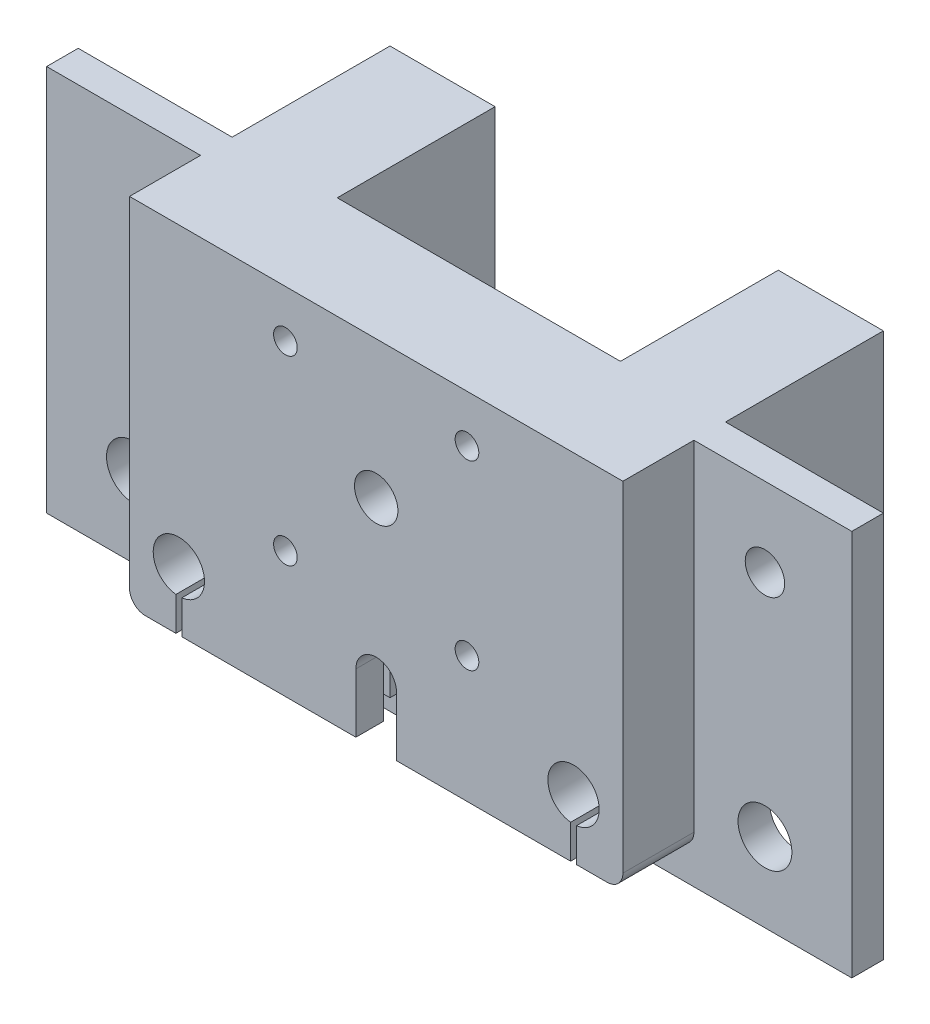
from build123d import *
from build123d.topology import SkipClean

# Parameters (mm, degrees)
SKETCH1_W           = 62.5
SKETCH1_H           = 45
BOSS_EXTRUDE1_DEPTH = 20
SKETCH2_W           = 37.5
SKETCH2_H           = 45
CUT_EXTRUDE1_DEPTH  = 5
SKETCH3_R           = 11.5
CUT_EXTRUDE2_DEPTH  = 2
SKETCH4_R           = 1.5
CUT_EXTRUDE3_DEPTH  = 15
CIRPATTERN1_COUNT   = 4
SKETCH5_R           = 2.75
CUT_EXTRUDE4_DEPTH  = 58.667690261
CUT_EXTRUDE7_START  = -6.5
CUT_EXTRUDE7_DEPTH  = 3
CUT_EXTRUDE8_DEPTH  = 6.5
CUT_EXTRUDE9_DEPTH  = 5.5
SKETCH11_R          = 1.375
CUT_EXTRUDE10_DEPTH = 80.569152314
FILLET1_R           = 2
SKETCH12_R          = 3.625
CUT_EXTRUDE12_DEPTH = 3
BOSS_EXTRUDE2_START = 20
BOSS_EXTRUDE2_DEPTH = 20
SKETCH14_R          = 4
CUT_EXTRUDE18_DEPTH = 2
SKETCH15_W          = 62.5
SKETCH15_H          = 45
CUT_EXTRUDE19_DEPTH = 7
SKETCH16_R          = 3.25
CUT_EXTRUDE20_DEPTH = 64.957505524
SKETCH17_R          = 1.375
CUT_EXTRUDE21_DEPTH = 79.008012512
SKETCH18_W          = 19.875
SKETCH18_H          = 4
BOSS_EXTRUDE3_DEPTH = 4
SKETCH19_R          = 3.41
SKETCH19_R_2        = 2.5
CUT_EXTRUDE22_DEPTH = 10


with BuildPart() as part:
    # Sketch1 → Boss-Extrude1 (new body)
    with BuildSketch(Plane.XY):
        with Locations((0, 22.5)):
            Rectangle(SKETCH1_W, SKETCH1_H)
    extrude(amount=BOSS_EXTRUDE1_DEPTH)

    # Sketch2 → Cut-Extrude1 (cut)
    with BuildSketch(Plane.XY.offset(20)):
        with Locations((0, 22.5)):
            Rectangle(SKETCH2_W, SKETCH2_H)
    extrude(amount=-CUT_EXTRUDE1_DEPTH, mode=Mode.SUBTRACT)

    # Sketch3 → Cut-Extrude2 (cut)
    with BuildSketch(Plane(origin=(0, 0, 0), x_dir=(-1, 0, 0), z_dir=(0, 0, -1))):
        with Locations((0, 27.5)):
            Circle(SKETCH3_R)
    extrude(amount=-CUT_EXTRUDE2_DEPTH, mode=Mode.SUBTRACT)

    # Sketch4 → Cut-Extrude3 (cut)
    with BuildSketch(Plane(origin=(0, 0, 0), x_dir=(-1, 0, 0), z_dir=(0, 0, -1))):
        with Locations((11.5, 39)):
            Circle(SKETCH4_R)
    cut_extrude3 = extrude(amount=-CUT_EXTRUDE3_DEPTH, mode=Mode.SUBTRACT)

    # CirPattern1: Cut-Extrude3 ×4 about axis
    cirpattern1_axis = Axis((0, 27.5, 0), (0, 0, 1))
    for i in range(1, CIRPATTERN1_COUNT):
        add(cut_extrude3.rotate(cirpattern1_axis, i * 360 / CIRPATTERN1_COUNT), mode=Mode.SUBTRACT)

    # Sketch5 → Cut-Extrude4 (cut, through all)
    with BuildSketch(Plane(origin=(0, 0, 2), x_dir=(-1, 0, 0), z_dir=(0, 0, -1))):
        with Locations((0, 27.5)):
            Circle(SKETCH5_R)
    extrude(amount=-CUT_EXTRUDE4_DEPTH, mode=Mode.SUBTRACT)

    # Sketch8 → Cut-Extrude7 (cut)
    with BuildSketch(Plane(origin=(0, 0, 0), x_dir=(-1, 0, 0), z_dir=(0, 0, -1)).offset(CUT_EXTRUDE7_START)):
        with BuildLine():
            Line((7.125, 0), (-7.125, 0))
            Line((-7.125, 0), (-7.125, 11.75))
            ThreePointArc((-7.125, 11.75), (-6.539213562, 13.164213562), (-5.125, 13.75))
            Line((-5.125, 13.75), (5.125, 13.75))
            ThreePointArc((5.125, 13.75), (6.539213562, 13.164213562), (7.125, 11.75))
            Line((7.125, 11.75), (7.125, 0))
        make_face()
    extrude(amount=-CUT_EXTRUDE7_DEPTH, mode=Mode.SUBTRACT)

    # Sketch9 → Cut-Extrude8 (cut)
    with BuildSketch(Plane(origin=(0, 0, 0), x_dir=(-1, 0, 0), z_dir=(0, 0, -1))):
        with BuildLine():
            Line((4.75, 7.5), (4.75, 0))
            Line((4.75, 0), (-4.75, 0))
            Line((-4.75, 0), (-4.75, 7.5))
            ThreePointArc((-4.75, 7.5), (0, 12.25), (4.75, 7.5))
        make_face()
    extrude(amount=-CUT_EXTRUDE8_DEPTH, mode=Mode.SUBTRACT)

    # Sketch10 → Cut-Extrude9 (cut)
    with BuildSketch(Plane.XY.offset(15)):
        with BuildLine():
            Line((2.575, 7.5), (2.575, 0))
            Line((2.575, 0), (-2.575, 0))
            Line((-2.575, 0), (-2.575, 7.5))
            ThreePointArc((-2.575, 7.5), (0, 10.075), (2.575, 7.5))
        make_face()
    extrude(amount=-CUT_EXTRUDE9_DEPTH, mode=Mode.SUBTRACT)

    # Sketch11 → Cut-Extrude10 (cut, through all)
    with BuildSketch(Plane(origin=(31.25, 0, 0), x_dir=(0, 0, -1), z_dir=(1, 0, 0))):
        with Locations(Location((-17.5, 2.5, 0), (0, 0, 90))):
            Circle(SKETCH11_R)
    extrude(amount=-CUT_EXTRUDE10_DEPTH, mode=Mode.SUBTRACT)

    # Fillet1
    # the kernel refuses this fillet: 2 mm, written as the material it takes off along each edge
    with BuildSketch(Plane(origin=(31.25, 0, -5), x_dir=(0, 1, 0), z_dir=(0, 0, 1)), Plane(origin=(-31.25, 0, -5), x_dir=(1, 0, 0), z_dir=(0, 0, 1))) as fillet1_piece_1:
        with BuildLine():
            CenterArc((FILLET1_R, FILLET1_R), FILLET1_R, 180, 90)
            Line((0, FILLET1_R), (0, 0))
            Line((0, 0), (FILLET1_R, 0))
        make_face()
    extrude(amount=30, mode=Mode.SUBTRACT)

    # Sketch12 → Cut-Extrude12 (cut)
    with BuildSketch(Plane(origin=(31.25, 0, 0), x_dir=(0, 0, -1), z_dir=(1, 0, 0))):
        with Locations((-17.5, 2.5)):
            Circle(SKETCH12_R)
    cut_extrude12 = extrude(amount=-CUT_EXTRUDE12_DEPTH, mode=Mode.SUBTRACT)

    # Mirror3: Cut-Extrude12 across plane
    add(cut_extrude12.mirror(Plane(origin=(0, 0, 0), x_dir=(0, 0, 1), z_dir=(1, 0, 0))), mode=Mode.SUBTRACT)

    # Sketch13 → Boss-Extrude2 (add)
    with SkipClean():  # the faces are left unmerged after this step: merging them gives an invalid solid
        with BuildSketch(Plane(origin=(0, 0, 0), x_dir=(-1, 0, 0), z_dir=(0, 0, -1)).offset(BOSS_EXTRUDE2_START)):
            with BuildLine():
                Line((17.93986046, 0), (29.25, 0))
                ThreePointArc((29.25, 0), (30.664213562, 0.585786438), (31.25, 2))
                Line((31.25, 2), (31.25, 45))
                Line((31.25, 45), (17.93986046, 45))
                Line((17.93986046, 45), (17.93986046, 0))
            make_face()
        boss_extrude2 = extrude(amount=-BOSS_EXTRUDE2_DEPTH)

    # Sketch14 → Cut-Extrude18 (cut)
    with SkipClean():  # the faces are left unmerged after this step: merging them gives an invalid solid
        with BuildSketch(Plane.ZY.offset(31.25)):
            with BuildLine():
                ThreePointArc((-20, 3.891941091), (-20.187003937, 3.207106781), (-20.25, 2.5))
                ThreePointArc((-20.25, 2.5), (-19.58802197, 0.296001514), (-17.821195336, -1.178497685))
                ThreePointArc((-17.821195336, -1.178497685), (-14.259364049, -0.969491103), (-12.281373033, 2))
                Line((-12.281373033, 2), (-20, 2))
                Line((-20, 2), (-20, 3.891941091))
            make_face()
            with BuildLine():
                ThreePointArc((-12.25, 2.5), (-15.542893219, 6.437003937), (-20, 3.891941091))
                Line((-20, 3.891941091), (-20, 2))
                Line((-20, 2), (-12.281373033, 2))
                ThreePointArc((-12.281373033, 2), (-12.257850963, 2.24950835), (-12.25, 2.5))
            make_face()
            with BuildLine():
                ThreePointArc((-17.821195336, -1.178497685), (-19.58802197, 0.296001514), (-20.25, 2.5))
                Line((-20.25, 2.5), (-20.25, -1.178497685))
                Line((-20.25, -1.178497685), (-17.821195336, -1.178497685))
            make_face()
            with Locations((-6.25, 2.5)):
                Circle(SKETCH14_R)
        cut_extrude18 = extrude(amount=-CUT_EXTRUDE18_DEPTH, mode=Mode.SUBTRACT)

    # Sketch15 → Cut-Extrude19 (cut)
    with SkipClean():  # the faces are left unmerged after this step: merging them gives an invalid solid
        with BuildSketch(Plane.XY.offset(20)):
            with Locations((0, 22.5)):
                Rectangle(SKETCH15_W, SKETCH15_H)
        extrude(amount=-CUT_EXTRUDE19_DEPTH, mode=Mode.SUBTRACT)

    # Sketch16 → Cut-Extrude20 (cut, through all)
    with SkipClean():  # the faces are left unmerged after this step: merging them gives an invalid solid
        with BuildSketch(Plane.XY.offset(13)):
            with BuildLine():
                Line((-24.625, 0), (-24.625, 4.271707107))
                ThreePointArc((-24.625, 4.271707107), (-25, 4.25), (-25.375, 4.271707107))
                Line((-25.375, 4.271707107), (-25.375, 0))
                Line((-25.375, 0), (-24.625, 0))
            make_face()
            with Locations((-25, 7.5)):
                Circle(SKETCH16_R)
        cut_extrude20 = extrude(amount=-CUT_EXTRUDE20_DEPTH, mode=Mode.SUBTRACT)

    # Mirror4: Boss-Extrude2, Cut-Extrude18, Cut-Extrude20 across plane
    with SkipClean():  # the faces are left unmerged after this step: merging them gives an invalid solid
        add(boss_extrude2.mirror(Plane(origin=(0, 0, 0), x_dir=(0, 0, 1), z_dir=(1, 0, 0))))
        add(cut_extrude18.mirror(Plane(origin=(0, 0, 0), x_dir=(0, 0, 1), z_dir=(1, 0, 0))), mode=Mode.SUBTRACT)
        add(cut_extrude20.mirror(Plane(origin=(0, 0, 0), x_dir=(0, 0, 1), z_dir=(1, 0, 0))), mode=Mode.SUBTRACT)
    add(part.part.scale(1), mode=Mode.REPLACE)  # the faces are merged on a copy

    # Sketch17 → Cut-Extrude21 (cut, through all)
    with BuildSketch(Plane.ZY.offset(29.25)):
        with Locations(Location((-6.25, 2.5, 0), (0, 0, 180))):
            Circle(SKETCH17_R)
        with Locations(Location((-16.25, 2.5, 0), (0, 0, 180))):
            Circle(SKETCH17_R)
    extrude(amount=-CUT_EXTRUDE21_DEPTH, mode=Mode.SUBTRACT)

    # Sketch18 → Boss-Extrude3 (add)
    with BuildSketch(Plane(origin=(0, 0, 0), x_dir=(-1, 0, 0), z_dir=(0, 0, -1))):
        with BuildLine():
            Line((-51.25, 45), (-31.25, 45))
            Line((-31.25, 45), (-31.25, 2))
            ThreePointArc((-31.25, 2), (-30.664213562, 0.585786438), (-29.25, 0))
            Line((-29.25, 0), (-25.375, 0))
            Line((-25.375, 0), (-25.375, -4))
            Line((-25.375, -4), (-51.25, -4))
            Line((-51.25, -4), (-51.25, 45))
        make_face()
        with BuildLine():
            Line((50.75, -4), (50.75, 45))
            Line((50.75, 45), (31.25, 45))
            Line((31.25, 45), (31.25, 2))
            ThreePointArc((31.25, 2), (30.664213562, 0.585786438), (29.25, 0))
            Line((29.25, 0), (25.375, 0))
            Line((25.375, 0), (25.375, -4))
            Line((25.375, -4), (50.75, -4))
        make_face()
        with Locations((-14.6875, -2)):
            Rectangle(SKETCH18_W, SKETCH18_H)
        with Locations((14.6875, -2)):
            Rectangle(SKETCH18_W, SKETCH18_H)
    extrude(amount=-BOSS_EXTRUDE3_DEPTH)

    # Sketch19 → Cut-Extrude22 (cut)
    with BuildSketch(Plane(origin=(0, 0, 0), x_dir=(-1, 0, 0), z_dir=(0, 0, -1))):
        with Locations((-40.25, 6)):
            Circle(SKETCH19_R)
        with Locations((39.75, 6)):
            Circle(SKETCH19_R)
        with Locations((-40.25, 35)):
            Circle(SKETCH19_R_2)
    extrude(amount=-CUT_EXTRUDE22_DEPTH, mode=Mode.SUBTRACT)


solid = part.part
